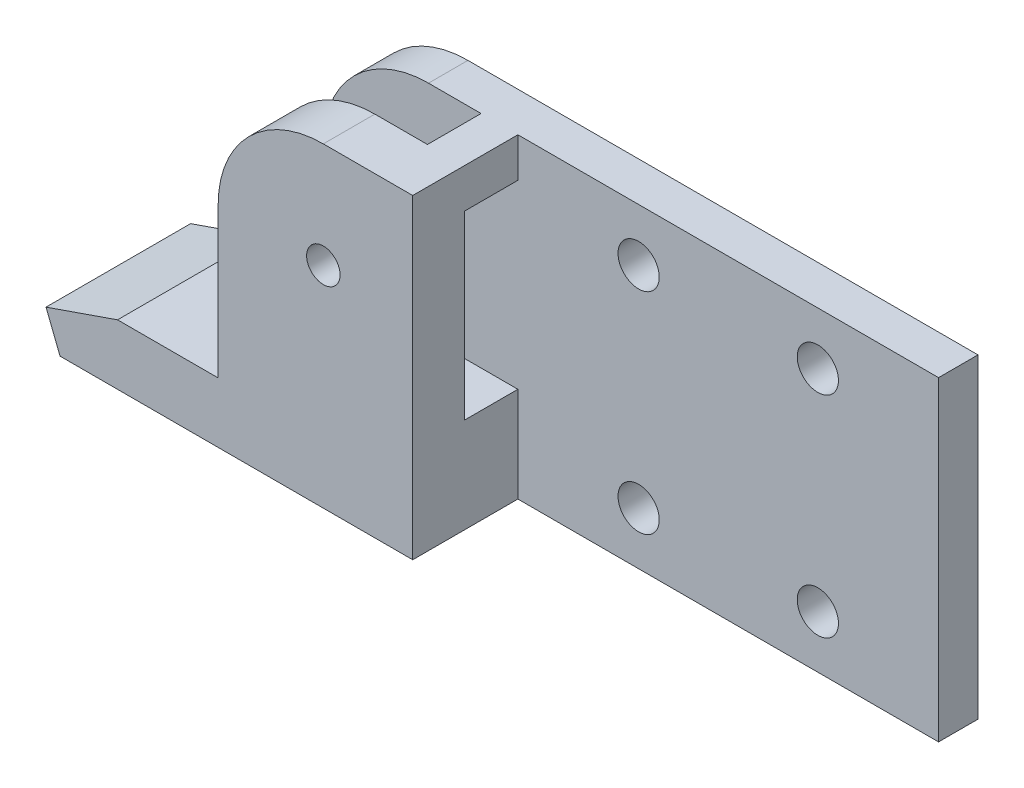
from build123d import *

# Parameters (mm, degrees)
SKETCH2_R                  = 3.175
BOSS_EXTRUDE1_DEPTH        = 4.7625
BOSS_EXTRUDE2_DEPTH        = 12.7
SKETCH12_W                 = 6.477
SKETCH12_H                 = 21.856650617
CUT_EXTRUDE1_DEPTH         = 24.13
SKETCH12_3_W               = 6.477
SKETCH12_3_H               = 4.7625
CUT_EXTRUDE2_DEPTH         = 19.05
TAP_DRILL_FOR_10_32_TAP1_D = 4.0386
F_10_CLEARANCE_HOLE2_D     = 4.9784


with BuildPart() as part:
    # Sketch2 → Boss-Extrude1 (new body)
    with BuildSketch(Plane.XY):
        with BuildLine():
            Line((-67.986186343, -228.533359856), (-69.686856366, -224.252380141))
            Line((-69.686856366, -224.252380141), (-61.0470258, -221.260552334))
            Line((-61.0470258, -221.260552334), (-48.895, -221.260552334))
            Line((-48.895, -221.260552334), (-48.895, -203.133359856))
            ThreePointArc((-48.895, -203.133359856), (-45.175256121, -194.153103735), (-36.195, -190.433359856))
            Line((-36.195, -190.433359856), (25.4, -190.433359856))
            Line((25.4, -190.433359856), (25.4, -228.533359856))
            Line((25.4, -228.533359856), (-67.986186343, -228.533359856))
        make_face()
        with Locations((-36.195, -203.133359856)):
            Circle(SKETCH2_R, mode=Mode.SUBTRACT)
    extrude(amount=BOSS_EXTRUDE1_DEPTH)

    # Sketch11 → Boss-Extrude2 (add)
    with BuildSketch(Plane(origin=(0, 0, 4.7625), x_dir=(-1, 0, 0), z_dir=(0, 0, -1))):
        with BuildLine():
            Line((25.4, -190.433359856), (25.4, -228.533359856))
            Line((25.4, -228.533359856), (67.986186343, -228.533359856))
            Line((67.986186343, -228.533359856), (69.686856366, -224.252380141))
            Line((69.686856366, -224.252380141), (61.0470258, -221.260552334))
            Line((61.0470258, -221.260552334), (48.895, -221.260552334))
            Line((48.895, -221.260552334), (48.895, -203.133359856))
            ThreePointArc((48.895, -203.133359856), (45.175256121, -194.153103735), (36.195, -190.433359856))
            Line((36.195, -190.433359856), (25.4, -190.433359856))
        make_face()
    extrude(amount=-BOSS_EXTRUDE2_DEPTH)

    # Sketch12 → Cut-Extrude1 (cut)
    with BuildSketch(Plane.ZY.offset(48.895)):
        with Locations((8.001, -206.124185165)):
            Rectangle(SKETCH12_W, SKETCH12_H)
    extrude(amount=-CUT_EXTRUDE1_DEPTH, mode=Mode.SUBTRACT)

    # Sketch12<3> → Cut-Extrude2 (cut)
    with BuildSketch(Plane.ZY.offset(48.895)):
        with Locations((8.001, -192.814609856)):
            Rectangle(SKETCH12_3_W, SKETCH12_3_H)
    extrude(amount=-CUT_EXTRUDE2_DEPTH, mode=Mode.SUBTRACT)

    # Tap Drill for #10-32 Tap1 (through all)
    with Locations(Plane(origin=(0, 0, 11.2395), x_dir=(1, 0, 0), z_dir=(0, 0, -1))):
        with Locations((-36.195, 203.133359856)):
            Hole(TAP_DRILL_FOR_10_32_TAP1_D / 2)

    # #10 Clearance Hole2 (through all)
    with Locations(Plane.XY.offset(4.7625)):
        with Locations((-10.8204, -196.783359856), (-10.8204, -222.183359856), (10.8204, -222.183359856), (10.8204, -196.783359856)):
            Hole(F_10_CLEARANCE_HOLE2_D / 2)


solid = part.part
